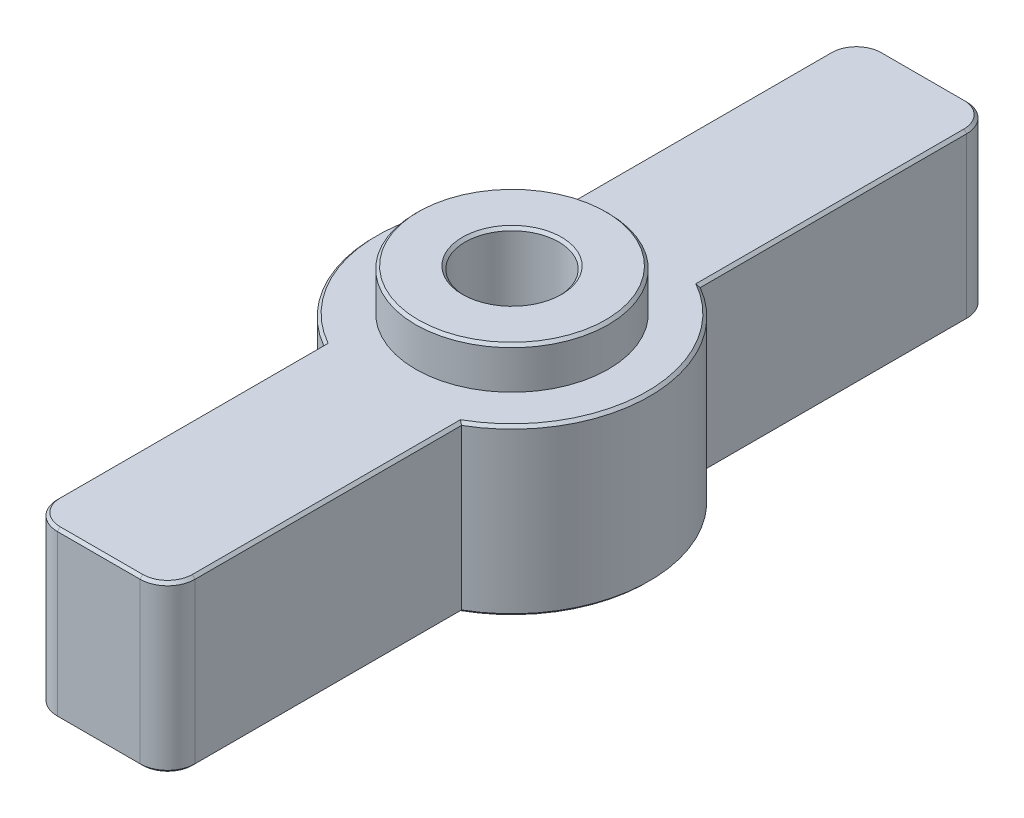
from build123d import *

# Parameters (mm, degrees)
EXTRUDE_1_DEPTH     = 12
SKETCH_2_R          = 6.75
CUT_EXTRUDE_1_DEPTH = 8.5
SKETCH_4_R          = 7
EXTRUDE_2_DEPTH     = 3
SKETCH_3_R          = 3.4
CUT_EXTRUDE_2_DEPTH = 33.74522866
CHAMFER_1_SIZE      = 0.2


with BuildPart() as part:
    # 草图1 → 凸台-拉伸1 (new body)
    with BuildSketch(Plane(origin=(0, 0, 0), x_dir=(1, 0, 0), z_dir=(0, 1, 0))):
        with BuildLine():
            Line((-5, -28), (-5, -8.660254038))
            ThreePointArc((-5, -8.660254038), (-10, 0), (-5, 8.660254038))
            Line((-5, 8.660254038), (-5, 28))
            ThreePointArc((-5, 28), (-4.414213562, 29.414213562), (-3, 30))
            Line((-3, 30), (3, 30))
            ThreePointArc((3, 30), (4.414213562, 29.414213562), (5, 28))
            Line((5, 28), (5, 8.660254038))
            ThreePointArc((5, 8.660254038), (10, 0), (5, -8.660254038))
            Line((5, -8.660254038), (5, -28))
            ThreePointArc((5, -28), (4.414213562, -29.414213562), (3, -30))
            Line((3, -30), (-3, -30))
            ThreePointArc((-3, -30), (-4.414213562, -29.414213562), (-5, -28))
        make_face()
    extrude(amount=EXTRUDE_1_DEPTH)

    # 草图2 → 切除-拉伸1 (cut)
    with BuildSketch(Plane.XZ):
        Circle(SKETCH_2_R)
    extrude(amount=-CUT_EXTRUDE_1_DEPTH, mode=Mode.SUBTRACT)

    # 草图4 → 凸台-拉伸2 (add)
    with BuildSketch(Plane(origin=(0, 12, 0), x_dir=(1, 0, 0), z_dir=(0, 1, 0))):
        Circle(SKETCH_4_R)
    extrude(amount=EXTRUDE_2_DEPTH)

    # 草图3 → 切除-拉伸2 (cut, through all)
    with BuildSketch(Plane.XZ.offset(-8.5)):
        Circle(SKETCH_3_R)
    extrude(amount=-CUT_EXTRUDE_2_DEPTH, mode=Mode.SUBTRACT)

    # 倒角1
    chamfer_1_edges = [part.edges().sort_by_distance(p)[0] for p in [
        (5, 12, 18.330127019),
        (4.414213562, 12, 29.414213562),
        (0, 12, 30),
        (-4.414213562, 12, 29.414213562),
        (-5, 12, 18.330127019),
        (-7, 15, 0),
        (-3.4, 15, 0),
        (5, 0, -18.330127019),
        (4.414213562, 0, -29.414213562),
        (0, 0, -30),
        (-4.414213562, 0, -29.414213562),
        (-5, 0, -18.330127019),
        (-5, 0, 18.330127019),
        (-4.414213562, 0, 29.414213562),
        (0, 0, 30),
        (4.414213562, 0, 29.414213562),
        (5, 0, 18.330127019),
        (-10, 0, 0),
        (-6.75, 0, 0),
        (-5, 12, -18.330127019),
        (-4.414213562, 12, -29.414213562),
        (0, 12, -30),
        (4.414213562, 12, -29.414213562),
        (5, 12, -18.330127019),
        (-10, 12, 0),
        (10, 12, 0),
        (10, 0, 0),
    ]]
    chamfer(chamfer_1_edges, length=CHAMFER_1_SIZE)


solid = part.part
